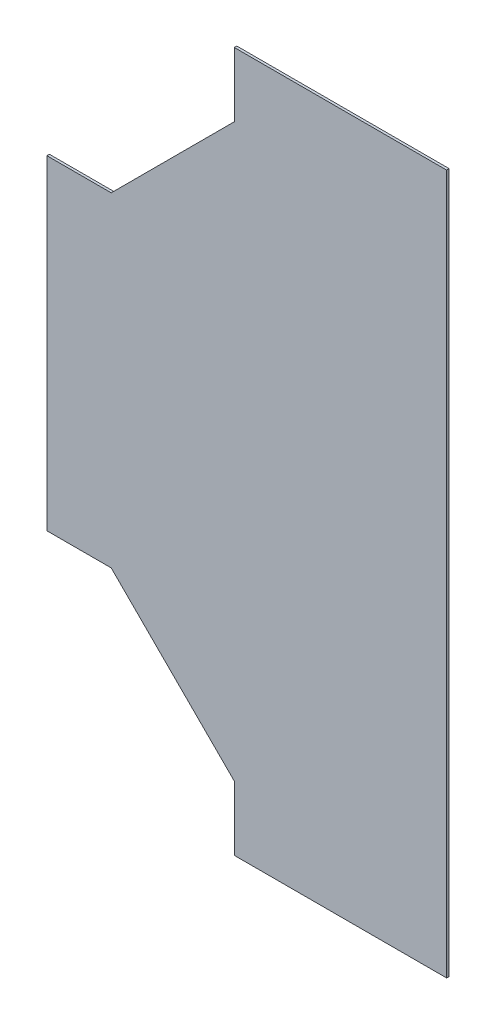
from build123d import *

# Parameters (mm, degrees)
SKETCH1_W           = 711.2
SKETCH1_H           = 406.4
BOSS_EXTRUDE1_DEPTH = 2.54
CUT_EXTRUDE1_DEPTH  = 410.570569743


with BuildPart() as part:
    # Sketch1 → Boss-Extrude1 (new body)
    with BuildSketch(Plane(origin=(0, 0, 0), x_dir=(0, 1, 0), z_dir=(0, 0, 1))):
        Rectangle(SKETCH1_W, SKETCH1_H)
    extrude(amount=BOSS_EXTRUDE1_DEPTH)

    # Sketch2 → Cut-Extrude1 (cut, through all)
    with BuildSketch(Plane.XY.offset(2.54)):
        Polygon((-137.76270055, 165.1), (-12.7, 290.16270055), (-12.7, 355.6), (-203.2, 355.6), (-203.2, 165.1), align=None)
        Polygon((-12.7, -355.6), (-203.2, -355.6), (-203.2, -165.1), (-137.76270055, -165.1), (-12.7, -290.16270055), align=None)
    extrude(amount=-CUT_EXTRUDE1_DEPTH, mode=Mode.SUBTRACT)


solid = part.part
